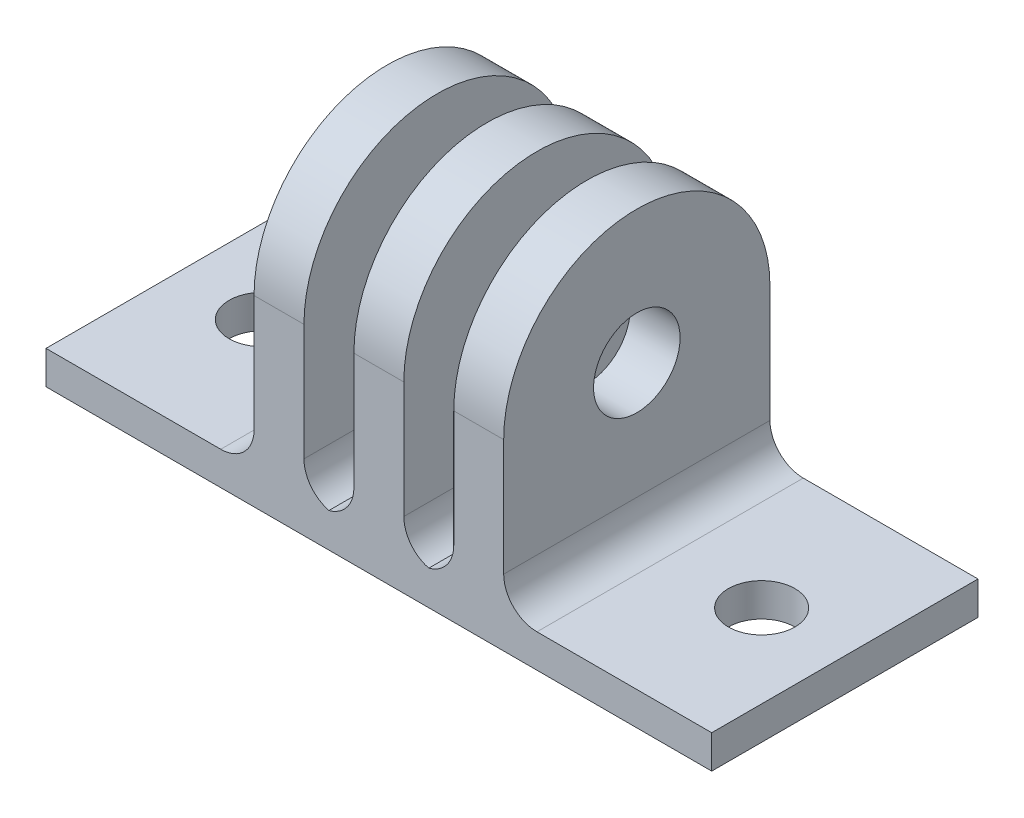
from build123d import *

# Parameters (mm, degrees)
SKETCH_1_W                 = 40
SKETCH_1_H                 = 16
SKETCH_1_R                 = 2
EXTRUDE_1_DEPTH            = 2
SKETCH_2_R                 = 2.6
EXTRUDE_2_DEPTH            = 1.5
PATTERN_LINEAR_1_COUNT     = 2
PATTERN_LINEAR_1_PITCH     = 6
PATTERN_LINEAR_1_COL_COUNT = 2
PATTERN_LINEAR_1_COL_PITCH = 6
FILLET_1_R                 = 2


with BuildPart() as part:
    # 草圖1 → 填料-伸長1 (new body)
    with BuildSketch(Plane(origin=(0, 0, 0), x_dir=(1, 0, 0), z_dir=(0, 1, 0))):
        Rectangle(SKETCH_1_W, SKETCH_1_H)
        with Locations(Location((-15, 0, 0), (0, 0, 270))):
            Circle(SKETCH_1_R, mode=Mode.SUBTRACT)
        with Locations(Location((15, 0, 0), (0, 0, 90))):
            Circle(SKETCH_1_R, mode=Mode.SUBTRACT)
    extrude(amount=EXTRUDE_1_DEPTH)

    # 草圖2 → 填料-伸長2 (add, symmetric)
    with BuildSketch(Plane(origin=(0, 0, 0), x_dir=(0, 0, -1), z_dir=(1, 0, 0))):
        with BuildLine():
            Line((8, 2), (-8, 2))
            Line((-8, 2), (-8, 11))
            ThreePointArc((-8, 11), (0, 19), (8, 11))
            Line((8, 11), (8, 2))
        make_face()
        with Locations((0, 11)):
            Circle(SKETCH_2_R, mode=Mode.SUBTRACT)
    extrude_2 = extrude(amount=EXTRUDE_2_DEPTH, both=True)

    # 直線複製排列1: 填料-伸長2 ×2
    with Locations(*[(i * PATTERN_LINEAR_1_PITCH, 0, 0) for i in range(1, PATTERN_LINEAR_1_COUNT)]):
        add(extrude_2)

    # 直線複製排列1 col: 填料-伸長2 ×2
    with Locations(*[(-i * PATTERN_LINEAR_1_COL_PITCH, 0, 0) for i in range(1, PATTERN_LINEAR_1_COL_COUNT)]):
        add(extrude_2)

    # 圓角1
    # the kernel refuses this fillet: 2 mm, written as the material it adds along each edge
    with BuildSketch(Plane(origin=(1.5, 2, -8), x_dir=(0, 1, 0), z_dir=(0, 0, 1)), Plane(origin=(-1.5, 2, -8), x_dir=(-1, 0, 0), z_dir=(0, 0, 1)), Plane(origin=(-7.5, 2, -8), x_dir=(-1, 0, 0), z_dir=(0, 0, 1)), Plane(origin=(7.5, 2, -8), x_dir=(0, 1, 0), z_dir=(0, 0, 1)), Plane(origin=(4.5, 2, -8), x_dir=(-1, 0, 0), z_dir=(0, 0, 1))) as fillet_1_piece_1:
        with BuildLine():
            CenterArc((FILLET_1_R, -FILLET_1_R), FILLET_1_R, 90, 90)
            Line((0, -FILLET_1_R), (0, 0))
            Line((0, 0), (FILLET_1_R, 0))
        make_face()
    extrude(amount=16)
    with BuildSketch(Plane(origin=(-4.5, 2, -8), x_dir=(1, 0, 0), z_dir=(0, 0, 1))) as fillet_1_piece_2:
        with BuildLine():
            CenterArc((FILLET_1_R, FILLET_1_R), FILLET_1_R, 180, 90)
            Line((0, FILLET_1_R), (0, 0))
            Line((0, 0), (FILLET_1_R, 0))
        make_face()
    extrude(amount=16)


solid = part.part
